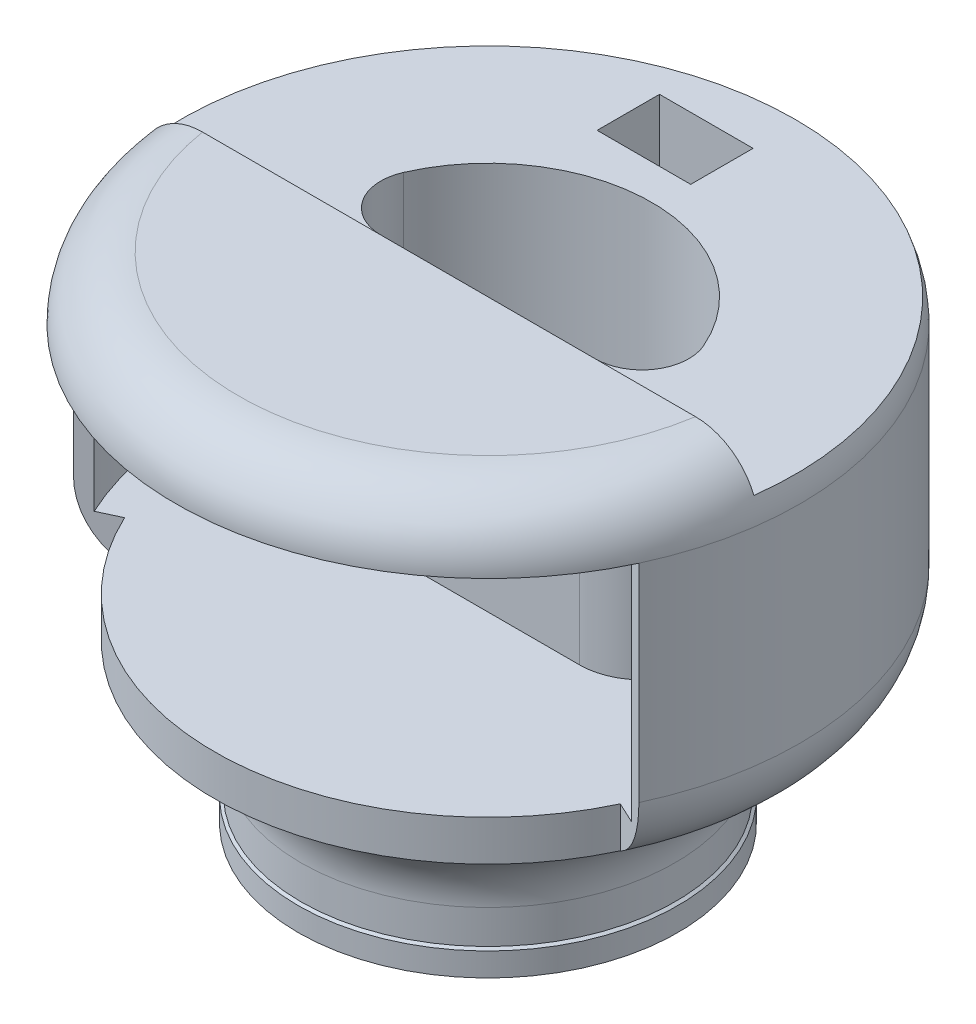
from build123d import *

# Parameters (mm, degrees)
CUT_EXTRUDE3_DEPTH           = 60
CUT_EXTRUDE5_DEPTH           = 2
CUT_EXTRUDE5_DEPTH_BACK      = 30
SKETCH9_R                    = 38
SKETCH9_R_2                  = 23
SKETCH19_W                   = 12
SKETCH19_H                   = 36.5
CUT_REVOLVE2_ANGLE           = 65
CUT_REVOLVE2_OTHER_WAY_ANGLE = 65
SKETCH21_W                   = 3.25
SKETCH21_H                   = 4
BOSS_EXTRUDE3_DEPTH          = 1.35
CIRPATTERN1_COUNT            = 5
CUT_EXTRUDE9_START           = -5
CUT_EXTRUDE9_DEPTH           = 5
SKETCH23_R                   = 10.5
CUT_EXTRUDE10_DEPTH          = 10
SKETCH24_W                   = 17
SKETCH24_H                   = 12
BOSS_EXTRUDE4_DEPTH          = 8
SKETCH26_W                   = 12
SKETCH26_H                   = 8
CUT_EXTRUDE11_DEPTH          = 10
SKETCH27_W                   = 4
SKETCH27_H                   = 5
CUT_EXTRUDE12_DEPTH          = 5
CUT_EXTRUDE14_DEPTH          = 2
CUT_EXTRUDE14_DEPTH_BACK     = 30
SKETCH29_R                   = 1
CUT_EXTRUDE15_DEPTH          = 15
FILLET1_R                    = 6
FILLET2_R                    = 8
SKETCH30_W                   = 97.703590575
SKETCH30_H                   = 5
CUT_EXTRUDE16_DEPTH          = 5


with BuildPart() as part:
    # Sketch1 → Revolve1 (revolve)
    with BuildSketch(Plane.XY):
        with BuildLine():
            Line((0, 63.427876097), (32, 63.427876097))
            ThreePointArc((32, 63.427876097), (37.656854249, 61.084730346), (40, 55.427876097))
            Line((40, 55.427876097), (40, 28.846818009))
            ThreePointArc((40, 28.846818009), (38.792081772, 24.082439968), (35.460140376, 20.469057744))
            Line((35.460140376, 20.469057744), (28.539859624, 15.958818353))
            ThreePointArc((28.539859624, 15.958818353), (25.207918228, 12.345436129), (24, 7.581058088))
            Line((24, 7.581058088), (24, 3.25))
            Line((24, 3.25), (24.35, 3))
            Line((24.35, 3), (24.35, 0))
            Line((24.35, 0), (22.5, 0))
            Line((22.5, 0), (22.5, 12.5))
            ThreePointArc((22.5, 12.5), (22.353553391, 12.853553391), (22, 13))
            Line((22, 13), (0, 13))
            Line((0, 13), (0, 63.427876097))
        make_face()
    revolve(axis=Axis((0, 0, 0), (0, 1, 0)))

    # Sketch11 → Cut-Extrude3 (cut)
    with BuildSketch(Plane(origin=(0, 13, 0), x_dir=(-1, 0, 0), z_dir=(0, -1, 0))):
        with BuildLine():
            Line((-21, 0), (21, 0))
            ThreePointArc((21, 0), (0, 21), (-21, 0))
        make_face()
    extrude(amount=-CUT_EXTRUDE3_DEPTH, mode=Mode.SUBTRACT)

    # Sketch9 → Cut-Extrude5 (cut, two sides: drawn at the far end of the back side and taken through both)
    with BuildSketch(Plane(origin=(0, 55.427876097, 0), x_dir=(1, 0, 0), z_dir=(0, 1, 0)).offset(-CUT_EXTRUDE5_DEPTH_BACK)):
        Circle(SKETCH9_R)
        Circle(SKETCH9_R_2, mode=Mode.SUBTRACT)
    extrude(amount=CUT_EXTRUDE5_DEPTH + CUT_EXTRUDE5_DEPTH_BACK, mode=Mode.SUBTRACT)

    # Sketch19 → Cut-Revolve2 (revolve, cut)
    with BuildSketch(Plane(origin=(0, 0, 0), x_dir=(0, 0, -1), z_dir=(1, 0, 0))):
        with Locations((-41.064715832, 37.177876097)):
            Rectangle(SKETCH19_W, SKETCH19_H)
    revolve(axis=Axis((0, 0, 0), (0, 1, 0)), revolution_arc=CUT_REVOLVE2_ANGLE, mode=Mode.SUBTRACT)

    # Sketch19 → Cut-Revolve2 other way (revolve, cut)
    with BuildSketch(Plane(origin=(0, 0, 0), x_dir=(0, 0, -1), z_dir=(1, 0, 0))):
        with Locations((-41.064715832, 37.177876097)):
            Rectangle(SKETCH19_W, SKETCH19_H)
    revolve(axis=Axis((0, 0, 0), (0, -1, 0)), revolution_arc=CUT_REVOLVE2_OTHER_WAY_ANGLE, mode=Mode.SUBTRACT)

    # Sketch21 → Boss-Extrude3 (add)
    with BuildSketch(Plane(origin=(0, 0, 22.5), x_dir=(-1, 0, 0), z_dir=(0, 0, -1))):
        with Locations((0, 2)):
            Rectangle(SKETCH21_W, SKETCH21_H)
    boss_extrude3 = extrude(amount=BOSS_EXTRUDE3_DEPTH)

    # CirPattern1: Boss-Extrude3 ×5 about axis
    cirpattern1_axis = Axis((0, 0, 0), (0, -1, 0))
    for i in range(1, CIRPATTERN1_COUNT):
        add(boss_extrude3.rotate(cirpattern1_axis, i * 360 / CIRPATTERN1_COUNT))

    # Sketch22 → Cut-Extrude9 (cut)
    with BuildSketch(Plane(origin=(0, 63.427876097, 0), x_dir=(1, 0, 0), z_dir=(0, 1, 0)).offset(CUT_EXTRUDE9_START)):
        with BuildLine():
            Line((-40, 0), (40, 0))
            ThreePointArc((40, 0), (0, 40), (-40, 0))
        make_face()
    extrude(amount=CUT_EXTRUDE9_DEPTH, mode=Mode.SUBTRACT)

    # Sketch23 → Cut-Extrude10 (cut)
    with BuildSketch(Plane(origin=(0, 0, -40), x_dir=(-1, 0, 0), z_dir=(0, 0, -1))):
        with Locations((0, 42.137876097)):
            Circle(SKETCH23_R)
    extrude(amount=-CUT_EXTRUDE10_DEPTH, mode=Mode.SUBTRACT)

    # Sketch24 → Boss-Extrude4 (add)
    with BuildSketch(Plane(origin=(0, 58.427876097, 0), x_dir=(1, 0, 0), z_dir=(0, 1, 0))):
        with Locations((-5.5, 30)):
            Rectangle(SKETCH24_W, SKETCH24_H)
    extrude(amount=-BOSS_EXTRUDE4_DEPTH)

    # Sketch26 → Cut-Extrude11 (cut)
    with BuildSketch(Plane(origin=(0, 58.427876097, 0), x_dir=(1, 0, 0), z_dir=(0, 1, 0))):
        with Locations((-5.5, 29.491524206)):
            Rectangle(SKETCH26_W, SKETCH26_H)
    extrude(amount=-CUT_EXTRUDE11_DEPTH, mode=Mode.SUBTRACT)

    # Sketch27 → Cut-Extrude12 (cut)
    with BuildSketch(Plane(origin=(3, 0, 0), x_dir=(0, 0, -1), z_dir=(1, 0, 0))):
        with Locations((29.5, 53.927876097)):
            Rectangle(SKETCH27_W, SKETCH27_H)
    extrude(amount=-CUT_EXTRUDE12_DEPTH, mode=Mode.SUBTRACT)

    # Sketch28 → Cut-Extrude14 (cut, two sides: drawn at the far end of the back side and taken through both)
    with BuildSketch(Plane(origin=(0, 55.427876097, 0), x_dir=(1, 0, 0), z_dir=(0, 1, 0)).offset(-CUT_EXTRUDE14_DEPTH_BACK)):
        with BuildLine():
            Line((-22.912878475, -2), (22.912878475, -2))
            ThreePointArc((22.912878475, -2), (0, -23), (-22.912878475, -2))
        make_face()
    extrude(amount=CUT_EXTRUDE14_DEPTH + CUT_EXTRUDE14_DEPTH_BACK, mode=Mode.SUBTRACT)

    # Sketch29 → Cut-Extrude15 (cut)
    with BuildSketch(Plane(origin=(0, 0, 0), x_dir=(-1, 0, 0), z_dir=(0, 0, -1))):
        with Locations((-30.416198487, 60.927876097)):
            Circle(SKETCH29_R)
        with Locations((30.416198487, 60.927876097)):
            Circle(SKETCH29_R)
        with Locations((0, 60.927876097)):
            Circle(SKETCH29_R)
    extrude(amount=-CUT_EXTRUDE15_DEPTH, mode=Mode.SUBTRACT)

    # Fillet1
    fillet1_edges = [part.edges().sort_by_distance(p)[0] for p in [
        (-21, 35.713938048, 0),
        (21, 35.713938048, 0),
    ]]
    fillet(fillet1_edges, radius=FILLET1_R)

    # Fillet2
    fillet2_edges = [part.edges().sort_by_distance(p)[0] for p in [
        (22.912878475, 41.427876097, 2),
        (-22.912878475, 41.427876097, 2),
    ]]
    fillet(fillet2_edges, radius=FILLET2_R)

    # Sketch30 → Cut-Extrude16 (cut)
    with BuildSketch(Plane(origin=(0, 63.427876097, 0), x_dir=(1, 0, 0), z_dir=(0, 1, 0))):
        with Locations((-0.528699084, -2.5)):
            Rectangle(SKETCH30_W, SKETCH30_H)
    extrude(amount=-CUT_EXTRUDE16_DEPTH, mode=Mode.SUBTRACT)


solid = part.part
